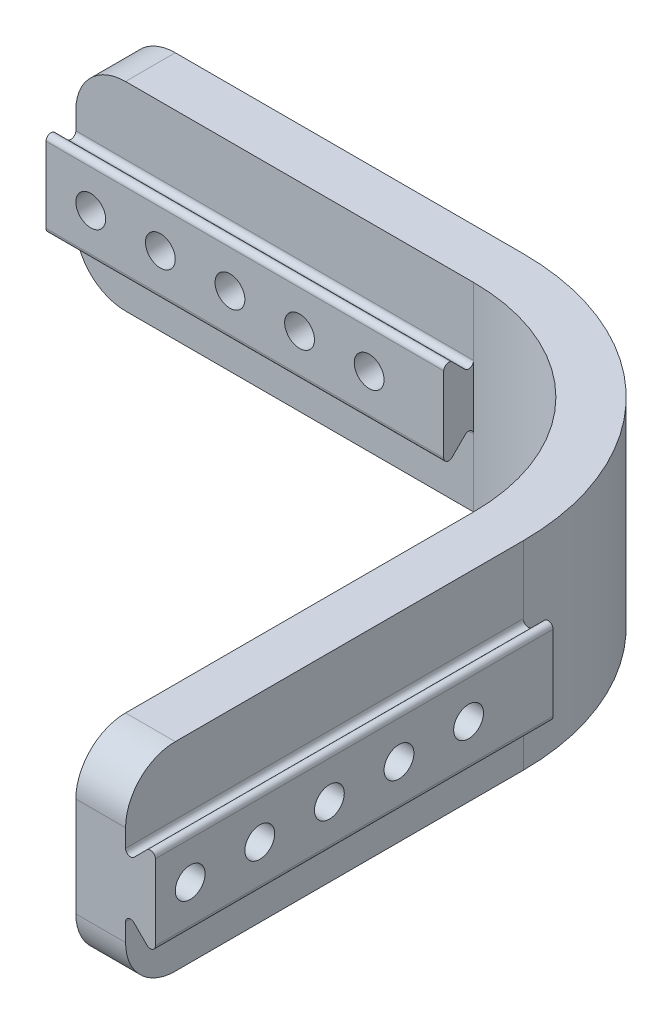
from build123d import *

# Parameters (mm, degrees)
BOSS_EXTRUDE1_DEPTH = 20
BOSS_EXTRUDE2_DEPTH = 40
BOSS_EXTRUDE3_DEPTH = 40
SKETCH4_R           = 1.5
CUT_EXTRUDE1_DEPTH  = 75
LPATTERN1_COUNT     = 5
LPATTERN1_PITCH     = 7
SKETCH5_R           = 1.5
CUT_EXTRUDE2_DEPTH  = 14
LPATTERN2_COUNT     = 5
LPATTERN2_PITCH     = 7
FILLET1_R           = 0.5
FILLET2_R           = 5


with BuildPart() as part:
    # Sketch1 → Boss-Extrude1 (new body)
    with BuildSketch(Plane(origin=(0, 0, 0), x_dir=(1, 0, 0), z_dir=(0, 1, 0))):
        with BuildLine():
            Line((0, 0), (40, 0))
            ThreePointArc((40, 0), (57.67766953, -7.32233047), (65, -25))
            Line((65, -25), (65, -65))
            Line((65, -65), (60, -65))
            Line((60, -65), (60, -25))
            ThreePointArc((60, -25), (54.142135624, -10.857864376), (40, -5))
            Line((40, -5), (0, -5))
            Line((0, -5), (0, 0))
        make_face()
    extrude(amount=BOSS_EXTRUDE1_DEPTH)

    # Sketch2 → Boss-Extrude2 (add)
    with BuildSketch(Plane(origin=(0, 0, 0), x_dir=(0, 0, -1), z_dir=(1, 0, 0))):
        Polygon((-8, 15), (-8, 5), (-5, 8), (-5, 12), align=None)
    extrude(amount=BOSS_EXTRUDE2_DEPTH)

    # Sketch3 → Boss-Extrude3 (add)
    with BuildSketch(Plane.XY.offset(65)):
        Polygon((65, 12), (65, 8), (68, 5), (68, 15), align=None)
    extrude(amount=-BOSS_EXTRUDE3_DEPTH)

    # Sketch4 → Cut-Extrude1 (cut)
    with BuildSketch(Plane(origin=(0, 0, 0), x_dir=(0, 0, -1), z_dir=(1, 0, 0))):
        with Locations((-61.5, 10)):
            Circle(SKETCH4_R)
    cut_extrude1 = extrude(amount=CUT_EXTRUDE1_DEPTH, mode=Mode.SUBTRACT)

    # LPattern1: Cut-Extrude1 ×5
    with Locations(*[(0, 0, -i * LPATTERN1_PITCH) for i in range(1, LPATTERN1_COUNT)]):
        add(cut_extrude1, mode=Mode.SUBTRACT)

    # Sketch5 → Cut-Extrude2 (cut)
    with BuildSketch(Plane.XY):
        with Locations((4.5, 10)):
            Circle(SKETCH5_R)
    cut_extrude2 = extrude(amount=CUT_EXTRUDE2_DEPTH, mode=Mode.SUBTRACT)

    # LPattern2: Cut-Extrude2 ×5
    with Locations(*[(i * LPATTERN2_PITCH, 0, 0) for i in range(1, LPATTERN2_COUNT)]):
        add(cut_extrude2, mode=Mode.SUBTRACT)

    # Fillet1
    fillet1_edges = [part.edges().sort_by_distance(p)[0] for p in [
        (68, 5, 45),
        (65, 8, 45),
        (65, 12, 45),
        (68, 15, 45),
        (20, 8, 5),
        (20, 5, 8),
        (20, 12, 5),
        (20, 15, 8),
    ]]
    fillet(fillet1_edges, radius=FILLET1_R)

    # Fillet2
    fillet2_edges = [part.edges().sort_by_distance(p)[0] for p in [
        (62.5, 0, 65),
        (62.5, 20, 65),
        (0, 0, 2.5),
        (0, 20, 2.5),
    ]]
    fillet(fillet2_edges, radius=FILLET2_R)


solid = part.part
